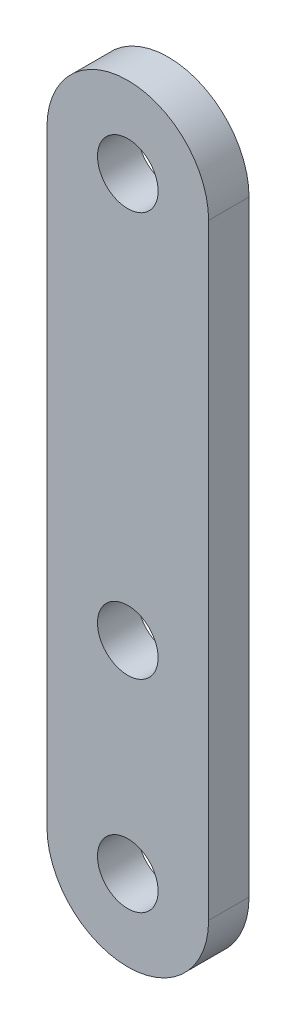
from build123d import *

# Parameters (mm, degrees)
BOSS_EXTRUDE1_DEPTH = 2
SKETCH3_R           = 1.5
CUT_EXTRUDE1_DEPTH  = 2
WRAP1_START         = -1
WRAP1_DEPTH         = 1


# Read off the part's stored shape, not the designer's step: Wrap1
with BuildPart() as part:
    # Sketch2 → Boss-Extrude1 (new body)
    with BuildSketch(Plane.XY):
        with BuildLine():
            Line((4, 15), (4, -15))
            ThreePointArc((4, -15), (0, -19), (-4, -15))
            Line((-4, -15), (-4, 15))
            ThreePointArc((-4, 15), (0, 19), (4, 15))
        make_face()
    extrude(amount=BOSS_EXTRUDE1_DEPTH)

    # Sketch3 → Cut-Extrude1 (cut)
    with BuildSketch(Plane.XY.offset(2)):
        with Locations((0, 15)):
            Circle(SKETCH3_R)
        with Locations((0, -5)):
            Circle(SKETCH3_R)
        with Locations((0, -15)):
            Circle(SKETCH3_R)
    extrude(amount=-CUT_EXTRUDE1_DEPTH, mode=Mode.SUBTRACT)

    # Wrap1 outline → Wrap1 (cut)
    # profile 1 of 3: a face of its own
    with BuildSketch(Plane(origin=(0, 0, 0), x_dir=(-1, 0, 0), z_dir=(0, 0, -1)).offset(WRAP1_START)):
        with BuildLine():
            add(Edge.make_bspline(
                [(-0.607041834, 1.376807805), (-0.638450439, 1.381215504), (-0.699799218, 1.389824829), (-0.788829434, 1.410988918), (-0.873490602, 1.435463903), (-0.953328371, 1.466763948), (-1.028256676, 1.502894203), (-1.098342568, 1.545026984), (-1.164591837, 1.591207302), (-1.204292974, 1.627363605), (-1.224029014, 1.645337453)],
                knots=[0, 0, 0, 0, 0.138943325, 0.2713907, 0.400711228, 0.524932707, 0.646800357, 0.764858493, 0.883107579, 1, 1, 1, 1], degree=3))
            Line((-0.607041834, 1.376807805), (-0.607041834, 2.005012933))
            add(Edge.make_bspline(
                [(-0.921144398, 2.414468062), (-0.920024021, 2.391706357), (-0.91780085, 2.346540165), (-0.901207686, 2.280493672), (-0.873275159, 2.217771509), (-0.834757851, 2.159672473), (-0.788500197, 2.107035237), (-0.733717607, 2.063835252), (-0.673692202, 2.027903553), (-0.629345719, 2.012673053), (-0.607041834, 2.005012933)],
                knots=[0, 0, 0, 0, 0.123522589, 0.245106649, 0.36726561, 0.494690546, 0.622323873, 0.746002836, 0.872253148, 1, 1, 1, 1], degree=3))
            add(Edge.make_bspline(
                [(-0.591617155, 2.767833446), (-0.614408848, 2.766626621), (-0.658893408, 2.764271153), (-0.722673727, 2.745618521), (-0.77982987, 2.713964233), (-0.829722525, 2.671014411), (-0.870420616, 2.618250087), (-0.90068952, 2.557184991), (-0.918347284, 2.488128552), (-0.920190911, 2.439577642), (-0.921144398, 2.414468062)],
                knots=[0, 0, 0, 0, 0.126165598, 0.246248538, 0.364494603, 0.485724426, 0.608514578, 0.73130473, 0.861036067, 1, 1, 1, 1], degree=3))
            add(Edge.make_bspline(
                [(-0.158323886, 2.094756523), (-0.161856976, 2.136403308), (-0.168466688, 2.214316196), (-0.184141308, 2.322389085), (-0.204418345, 2.413682313), (-0.230844819, 2.489239384), (-0.261712844, 2.553016018), (-0.297478631, 2.607948692), (-0.338548943, 2.655875804), (-0.384863938, 2.695297854), (-0.433411497, 2.728150331), (-0.485044359, 2.750639585), (-0.537708203, 2.765713476), (-0.573755622, 2.767131041), (-0.591617155, 2.767833446)],
                knots=[0, 0, 0, 0, 0.141725991, 0.265141262, 0.370116044, 0.458355648, 0.535986621, 0.609852304, 0.680090865, 0.749211452, 0.815601441, 0.878051616, 0.93957445, 1, 1, 1, 1], degree=3))
            Line((-0.158323886, 2.094756523), (0.425009448, 2.094756523))
            add(Edge.make_bspline(
                [(0.990814736, 2.947320626), (0.971596838, 2.946680769), (0.933568281, 2.945414614), (0.87783925, 2.934272515), (0.824024825, 2.917594437), (0.772569015, 2.893608264), (0.723774436, 2.862221289), (0.677236971, 2.824057947), (0.633327133, 2.778773001), (0.590766092, 2.727882924), (0.553508358, 2.669334389), (0.519199557, 2.605491679), (0.491881295, 2.534781974), (0.467486986, 2.458901612), (0.449668275, 2.376423863), (0.436730585, 2.287858394), (0.427100353, 2.193348802), (0.425718748, 2.128202081), (0.425009448, 2.094756523)],
                knots=[0, 0, 0, 0, 0.050616766, 0.100160932, 0.149266408, 0.198883313, 0.249304704, 0.301846101, 0.357178164, 0.415398685, 0.476408327, 0.539798233, 0.60615782, 0.675919782, 0.74976587, 0.828276339, 0.911839098, 1, 1, 1, 1], degree=3))
            add(Edge.make_bspline(
                [(1.501932525, 2.396238895), (1.501597667, 2.415657784), (1.500941755, 2.453695043), (1.493737852, 2.509580375), (1.48173522, 2.562764484), (1.465866162, 2.613689045), (1.444331937, 2.661553762), (1.419341541, 2.707442377), (1.388749512, 2.750515685), (1.353892799, 2.790522767), (1.316672247, 2.827756007), (1.275943207, 2.859548883), (1.233661347, 2.886997261), (1.188708299, 2.908655877), (1.142503153, 2.926782799), (1.093577308, 2.93808828), (1.042992772, 2.94657323), (1.008380951, 2.947069008), (0.990814736, 2.947320626)],
                knots=[0, 0, 0, 0, 0.069418935, 0.135976164, 0.201068785, 0.264244252, 0.326365932, 0.38847074, 0.450850536, 0.514855453, 0.578097235, 0.638796917, 0.699312171, 0.757998888, 0.816988375, 0.876385038, 0.937262852, 1, 1, 1, 1], degree=3))
            add(Edge.make_bspline(
                [(0.963470986, 1.825525754), (0.985482913, 1.829507401), (1.028356913, 1.837262702), (1.090435038, 1.852375264), (1.147714432, 1.872120836), (1.200615914, 1.894695884), (1.249682394, 1.91965525), (1.293601747, 1.949477365), (1.334100007, 1.981453289), (1.380650029, 2.029520388), (1.42946757, 2.096585003), (1.47270262, 2.187386549), (1.497292021, 2.288855454), (1.500351292, 2.359648416), (1.501932525, 2.396238895)],
                knots=[0, 0, 0, 0, 0.077370852, 0.150700025, 0.220747386, 0.286665961, 0.349581574, 0.410791325, 0.470003976, 0.527741387, 0.64173813, 0.755286834, 0.87351607, 1, 1, 1, 1], degree=3))
            Line((0.963470986, 1.825525754), (0.963470986, 1.197320626))
            add(Edge.make_bspline(
                [(2.130137653, 2.361883927), (2.129244443, 2.32093852), (2.12749789, 2.240875194), (2.112380589, 2.123765825), (2.087995156, 2.012464454), (2.053621865, 1.906687039), (2.009045581, 1.806842824), (1.955965229, 1.712026384), (1.891319257, 1.624129759), (1.818025906, 1.542173608), (1.735794929, 1.467975966), (1.646531164, 1.401660747), (1.549895179, 1.344690214), (1.446299841, 1.296830728), (1.335563415, 1.258456445), (1.217911087, 1.228186922), (1.093113003, 1.207043166), (1.007249266, 1.20060379), (0.963470986, 1.197320626)],
                knots=[0, 0, 0, 0, 0.066659045, 0.130342942, 0.191936224, 0.251995802, 0.311121943, 0.3697548, 0.428602208, 0.488435845, 0.548524359, 0.60866107, 0.669235799, 0.730880799, 0.794196272, 0.859830406, 0.928533466, 1, 1, 1, 1], degree=3))
            add(Edge.make_bspline(
                [(0.997124832, 3.575525754), (1.035959792, 3.574324369), (1.112534423, 3.571955483), (1.225320808, 3.556894847), (1.332853417, 3.528855746), (1.436365738, 3.491965145), (1.53453568, 3.442770599), (1.629562051, 3.384827245), (1.718222264, 3.31390278), (1.802217785, 3.234367643), (1.878955277, 3.146500397), (1.946753702, 3.05194954), (2.00264275, 2.950531882), (2.050413224, 2.844699317), (2.085866427, 2.732067664), (2.111829289, 2.614093898), (2.127625884, 2.48991653), (2.129288529, 2.405166415), (2.130137653, 2.361883927)],
                knots=[0, 0, 0, 0, 0.062826775, 0.123881606, 0.183570574, 0.242287944, 0.301291813, 0.360878938, 0.421986412, 0.484557904, 0.547788277, 0.610411137, 0.672354816, 0.73480514, 0.797929196, 0.862961244, 0.93001333, 1, 1, 1, 1], degree=3))
            add(Edge.make_bspline(
                [(0.1017923, 2.927689216), (0.109982102, 2.952637821), (0.126074696, 3.001660711), (0.157788454, 3.071326804), (0.19237269, 3.137625825), (0.232746087, 3.199041536), (0.276110267, 3.257258119), (0.324796793, 3.310433679), (0.377555958, 3.35994518), (0.434949022, 3.404567769), (0.496021745, 3.444462432), (0.559676436, 3.479621209), (0.626145741, 3.50912603), (0.694941203, 3.53388928), (0.766739882, 3.552782953), (0.841298462, 3.566075337), (0.918437297, 3.573761164), (0.970699171, 3.574933151), (0.997124832, 3.575525754)],
                knots=[0, 0, 0, 0, 0.066210963, 0.130101573, 0.192891272, 0.254723742, 0.31534918, 0.375885633, 0.436387606, 0.497731609, 0.559069942, 0.62030329, 0.681020445, 0.742389955, 0.80461491, 0.86812333, 0.933317965, 1, 1, 1, 1], degree=3))
            add(Edge.make_bspline(
                [(-0.631581097, 3.396038575), (-0.593605669, 3.394551498), (-0.518614708, 3.391614932), (-0.409075812, 3.368391008), (-0.304574961, 3.331057226), (-0.206350342, 3.27797412), (-0.114504277, 3.211313337), (-0.032244536, 3.129566518), (0.041702819, 3.035014895), (0.081442635, 2.964035704), (0.1017923, 2.927689216)],
                knots=[0, 0, 0, 0, 0.124097087, 0.245057399, 0.36448446, 0.485868975, 0.60892619, 0.734308661, 0.863946782, 1, 1, 1, 1], degree=3))
            add(Edge.make_bspline(
                [(-1.549349527, 2.418674792), (-1.548548686, 2.452597157), (-1.546974395, 2.519281689), (-1.53433684, 2.617291173), (-1.512171976, 2.710735013), (-1.483191913, 2.80060094), (-1.443759695, 2.885567316), (-1.397987282, 2.967509434), (-1.341845516, 3.044137827), (-1.27841097, 3.115631792), (-1.209800299, 3.181312633), (-1.136461134, 3.23819253), (-1.060352533, 3.287093198), (-0.980842178, 3.327380881), (-0.897795527, 3.358356633), (-0.811692331, 3.379854725), (-0.722722581, 3.393925747), (-0.662251041, 3.395327589), (-0.631581097, 3.396038575)],
                knots=[0, 0, 0, 0, 0.068213911, 0.134094803, 0.198285615, 0.261160186, 0.323634654, 0.38636675, 0.449642386, 0.514244902, 0.578413338, 0.640374686, 0.70061485, 0.760103977, 0.81929898, 0.878465984, 0.938360402, 1, 1, 1, 1], degree=3))
            add(Edge.make_bspline(
                [(-1.224029014, 1.645337453), (-1.250109546, 1.67119841), (-1.301511534, 1.722167638), (-1.367351802, 1.807343196), (-1.424332077, 1.896622911), (-1.469506451, 1.991797326), (-1.506069873, 2.091385457), (-1.530629606, 2.196179261), (-1.546925206, 2.305750515), (-1.54853038, 2.380519111), (-1.549349527, 2.418674792)],
                knots=[0, 0, 0, 0, 0.127406864, 0.251105539, 0.372907792, 0.494496302, 0.616171436, 0.740562898, 0.867604851, 1, 1, 1, 1], degree=3))
        make_face()
    # profile 2 of 3: a face of its own
    with BuildSketch(Plane(origin=(0, 0, 0), x_dir=(-1, 0, 0), z_dir=(0, 0, -1)).offset(WRAP1_START)):
        with BuildLine():
            add(Edge.make_bspline(
                [(-1.459605937, 4.995297389), (-1.459184531, 5.057010615), (-1.458369948, 5.176302979), (-1.448839901, 5.349109425), (-1.434846982, 5.509918159), (-1.413426234, 5.658362884), (-1.388580139, 5.794986577), (-1.35525072, 5.918752898), (-1.317246527, 6.030559296), (-1.272410618, 6.131491647), (-1.22016412, 6.223637339), (-1.161958934, 6.311131522), (-1.095670763, 6.393803845), (-1.022576334, 6.472814094), (-0.941338984, 6.547142732), (-0.853304139, 6.618027567), (-0.757195218, 6.683733026), (-0.655316596, 6.746245238), (-0.547236526, 6.802779217), (-0.433874961, 6.852090265), (-0.315961426, 6.89339843), (-0.193370255, 6.926963452), (-0.066508414, 6.953718649), (0.064880093, 6.972438721), (0.200673621, 6.984011656), (0.292707563, 6.985185633), (0.339472589, 6.985782164)],
                knots=[0, 0, 0, 0, 0.060148874, 0.116268453, 0.168655952, 0.21743294, 0.262424792, 0.303924461, 0.342252181, 0.37743397, 0.411399132, 0.445391786, 0.479760229, 0.514578736, 0.550208327, 0.586996019, 0.624658544, 0.663611474, 0.703452918, 0.743447125, 0.784010829, 0.825130466, 0.867263092, 0.910305411, 0.954423665, 1, 1, 1, 1], degree=3))
            Line((-1.459605937, 4.995297389), (-1.459605937, 4.203730882))
            Line((-1.459605937, 4.203730882), (2.040394063, 4.203730882))
            Line((2.040394063, 4.203730882), (2.040394063, 5.007216459))
            add(Edge.make_bspline(
                [(0.339472589, 6.985782164), (0.405461084, 6.984220124), (0.5353633, 6.981145157), (0.725993306, 6.955243354), (0.908731179, 6.913351367), (1.082147474, 6.854447429), (1.244697891, 6.781422314), (1.39351593, 6.694185637), (1.527802782, 6.594016489), (1.646889911, 6.482081856), (1.749246633, 6.36088388), (1.836908661, 6.234934848), (1.906034024, 6.103007311), (1.949880399, 5.986761867), (1.977124062, 5.885959785), (1.993310672, 5.797465963), (2.007754696, 5.696878012), (2.020655884, 5.583528945), (2.02925411, 5.457429918), (2.035275039, 5.318559589), (2.039725716, 5.167100164), (2.040165443, 5.061907485), (2.040394063, 5.007216459)],
                knots=[0, 0, 0, 0, 0.065772437, 0.129476892, 0.191428604, 0.252443711, 0.311784541, 0.368814691, 0.42408823, 0.478488396, 0.531389624, 0.581999458, 0.631196377, 0.67949774, 0.705555904, 0.735216023, 0.769126523, 0.806877245, 0.848930943, 0.895117474, 0.945470227, 1, 1, 1, 1], degree=3))
        make_face()
        with BuildLine():
            add(Edge.make_bspline(
                [(1.412188935, 5.16006101), (1.411999911, 5.199096077), (1.411636411, 5.274162137), (1.406641958, 5.382672945), (1.39853156, 5.482813663), (1.38653506, 5.574715461), (1.3721002, 5.658589614), (1.354246181, 5.734130173), (1.332534334, 5.801486026), (1.306946702, 5.861212619), (1.277732745, 5.91574168), (1.24361985, 5.966258445), (1.205709605, 6.015013278), (1.16292136, 6.061105096), (1.115812362, 6.104705474), (1.064142469, 6.145557236), (1.008068614, 6.184205427), (0.947294519, 6.219658081), (0.882461916, 6.252054902), (0.814198821, 6.280794514), (0.741936743, 6.304623893), (0.666352144, 6.324429414), (0.586786973, 6.338582704), (0.50383056, 6.350291852), (0.417154237, 6.356328259), (0.358176771, 6.357156718), (0.32825464, 6.357577036)],
                knots=[0, 0, 0, 0, 0.062612326, 0.120406111, 0.174204843, 0.223728185, 0.269030291, 0.310675957, 0.348139427, 0.382401014, 0.41477486, 0.447215928, 0.480063858, 0.51375667, 0.547979264, 0.582933279, 0.619329216, 0.657136258, 0.695697859, 0.735523522, 0.775831512, 0.817659023, 0.860747747, 0.905390435, 0.951999977, 1, 1, 1, 1], degree=3))
            Line((1.412188935, 5.16006101), (1.412188935, 4.83193601))
            Line((1.412188935, 4.83193601), (-0.831400809, 4.83193601))
            Line((-0.831400809, 4.83193601), (-0.831400809, 5.071719664))
            add(Edge.make_bspline(
                [(-0.550952091, 6.027348671), (-0.573736561, 6.001316476), (-0.620271262, 5.948148668), (-0.676031734, 5.854803467), (-0.725022774, 5.75194189), (-0.763867205, 5.637210773), (-0.794587038, 5.511718941), (-0.815773755, 5.374718962), (-0.829388114, 5.2269445), (-0.830715537, 5.124569796), (-0.831400809, 5.071719664)],
                knots=[0, 0, 0, 0, 0.101663476, 0.207636138, 0.318744567, 0.436679942, 0.563506646, 0.698681208, 0.844446556, 1, 1, 1, 1], degree=3))
            add(Edge.make_bspline(
                [(0.32825464, 6.357577036), (0.282400762, 6.356742908), (0.192989252, 6.355116424), (0.062776824, 6.339332908), (-0.059684213, 6.313901059), (-0.174079268, 6.276853884), (-0.281135601, 6.231295547), (-0.379473658, 6.173367169), (-0.470705304, 6.106587906), (-0.524214904, 6.053750154), (-0.550952091, 6.027348671)],
                knots=[0, 0, 0, 0, 0.142280365, 0.277435688, 0.406487662, 0.529917848, 0.650133875, 0.766844668, 0.88349908, 1, 1, 1, 1], degree=3))
        make_face(mode=Mode.SUBTRACT)
    # profile 3 of 3: a face of its own
    with BuildSketch(Plane(origin=(0, 0, 0), x_dir=(-1, 0, 0), z_dir=(0, 0, -1)).offset(WRAP1_START)):
        with BuildLine():
            add(Edge.make_bspline(
                [(-1.459605937, 8.315109087), (-1.45940088, 8.360919476), (-1.459005283, 8.449297319), (-1.454208126, 8.576745434), (-1.445611352, 8.694322577), (-1.434987028, 8.802001663), (-1.420092381, 8.899738649), (-1.403016098, 8.987655183), (-1.382214616, 9.06577191), (-1.357515892, 9.134961995), (-1.328422533, 9.197077012), (-1.297347603, 9.255788786), (-1.260513085, 9.310213665), (-1.220574083, 9.36162939), (-1.176699701, 9.409647027), (-1.12906334, 9.454622394), (-1.076972705, 9.496092373), (-1.020786655, 9.533796971), (-0.961649098, 9.568019643), (-0.899425174, 9.597913885), (-0.834024345, 9.622163689), (-0.765867539, 9.642505902), (-0.694958314, 9.658845062), (-0.620860409, 9.669720903), (-0.544091249, 9.677108328), (-0.491842108, 9.677760166), (-0.465415232, 9.678089857)],
                knots=[0, 0, 0, 0, 0.070782813, 0.136554884, 0.197017081, 0.252928598, 0.303693621, 0.349727315, 0.391249604, 0.428488557, 0.463067374, 0.497161963, 0.531014729, 0.564460573, 0.597691279, 0.631412817, 0.665589541, 0.700444444, 0.735874519, 0.771086765, 0.806970339, 0.84353075, 0.880937416, 0.9192925, 0.959179287, 1, 1, 1, 1], degree=3))
            Line((-1.459605937, 8.315109087), (-1.459605937, 7.613987292))
            Line((-1.459605937, 7.613987292), (2.040394063, 7.613987292))
            Line((2.040394063, 7.613987292), (2.040394063, 8.242192421))
            Line((2.040394063, 8.242192421), (0.514753037, 8.242192421))
            add(Edge.make_bspline(
                [(0.461467781, 8.955233286), (0.465931835, 8.937291065), (0.475602412, 8.898422437), (0.485420476, 8.834105533), (0.494447581, 8.759987054), (0.502205286, 8.675827327), (0.507478717, 8.581577831), (0.511597033, 8.477329825), (0.514591474, 8.363036066), (0.514697729, 8.283560705), (0.514753037, 8.242192421)],
                knots=[0, 0, 0, 0, 0.077372749, 0.167614291, 0.272108317, 0.390015992, 0.52136331, 0.667272254, 0.826809521, 1, 1, 1, 1], degree=3))
            add(Edge.make_bspline(
                [(-0.465415232, 9.678089857), (-0.436179808, 9.677612836), (-0.378728607, 9.676675431), (-0.294512192, 9.667485846), (-0.214219475, 9.651787124), (-0.137173286, 9.631269741), (-0.06464138, 9.602659613), (0.005107518, 9.569974225), (0.070115521, 9.529759546), (0.131204566, 9.483812544), (0.188838609, 9.43361579), (0.241475013, 9.378058637), (0.289098055, 9.317795464), (0.333767186, 9.254499868), (0.371905758, 9.185563719), (0.407480793, 9.11340023), (0.437624558, 9.036192692), (0.453446249, 8.982470312), (0.461467781, 8.955233286)],
                knots=[0, 0, 0, 0, 0.068872788, 0.135343493, 0.199281685, 0.261540067, 0.322903021, 0.382757342, 0.442826617, 0.502632784, 0.562727297, 0.622715739, 0.682661194, 0.743612561, 0.80501998, 0.868072172, 0.933113132, 1, 1, 1, 1], degree=3))
        make_face()
        with BuildLine():
            add(Edge.make_bspline(
                [(-0.113452091, 8.46444803), (-0.113708489, 8.504890995), (-0.114180265, 8.579306651), (-0.121003997, 8.680931492), (-0.131423195, 8.762601115), (-0.146372012, 8.827116484), (-0.169043648, 8.878072198), (-0.195316359, 8.921968473), (-0.228488602, 8.959932175), (-0.267032159, 8.992106105), (-0.310450752, 9.018250272), (-0.358628047, 9.036627966), (-0.410877041, 9.048216932), (-0.447356388, 9.049318324), (-0.466116354, 9.049884728)],
                knots=[0, 0, 0, 0, 0.155183108, 0.285539224, 0.390561991, 0.471046427, 0.538527135, 0.603746832, 0.666688199, 0.730994992, 0.79575053, 0.860207253, 0.928109812, 1, 1, 1, 1], degree=3))
            Line((-0.113452091, 8.46444803), (-0.113452091, 8.242192421))
            Line((-0.113452091, 8.242192421), (-0.831400809, 8.242192421))
            Line((-0.831400809, 8.242192421), (-0.831400809, 8.439908767))
            add(Edge.make_bspline(
                [(-0.761989751, 8.885121107), (-0.767608798, 8.874010313), (-0.779505472, 8.850486486), (-0.793336225, 8.810423129), (-0.805003988, 8.764190626), (-0.81468812, 8.711476857), (-0.822204011, 8.652492111), (-0.827951788, 8.587246912), (-0.830263193, 8.515645247), (-0.831011144, 8.465850573), (-0.831400809, 8.439908767)],
                knots=[0, 0, 0, 0, 0.08210116, 0.173824981, 0.278953094, 0.396639095, 0.527315592, 0.671298143, 0.82875438, 1, 1, 1, 1], degree=3))
            add(Edge.make_bspline(
                [(-0.466116354, 9.049884728), (-0.482511037, 9.049336208), (-0.514320664, 9.048271948), (-0.560197557, 9.04034585), (-0.602880406, 9.028044141), (-0.641774226, 9.009243367), (-0.677786178, 8.986417513), (-0.709795203, 8.957460079), (-0.7388369, 8.924066205), (-0.754189771, 8.898241348), (-0.761989751, 8.885121107)],
                knots=[0, 0, 0, 0, 0.137806221, 0.267377201, 0.390496855, 0.51006691, 0.629459141, 0.747795142, 0.871868075, 1, 1, 1, 1], degree=3))
        make_face(mode=Mode.SUBTRACT)
    extrude(amount=WRAP1_DEPTH, mode=Mode.SUBTRACT)


solid = part.part
